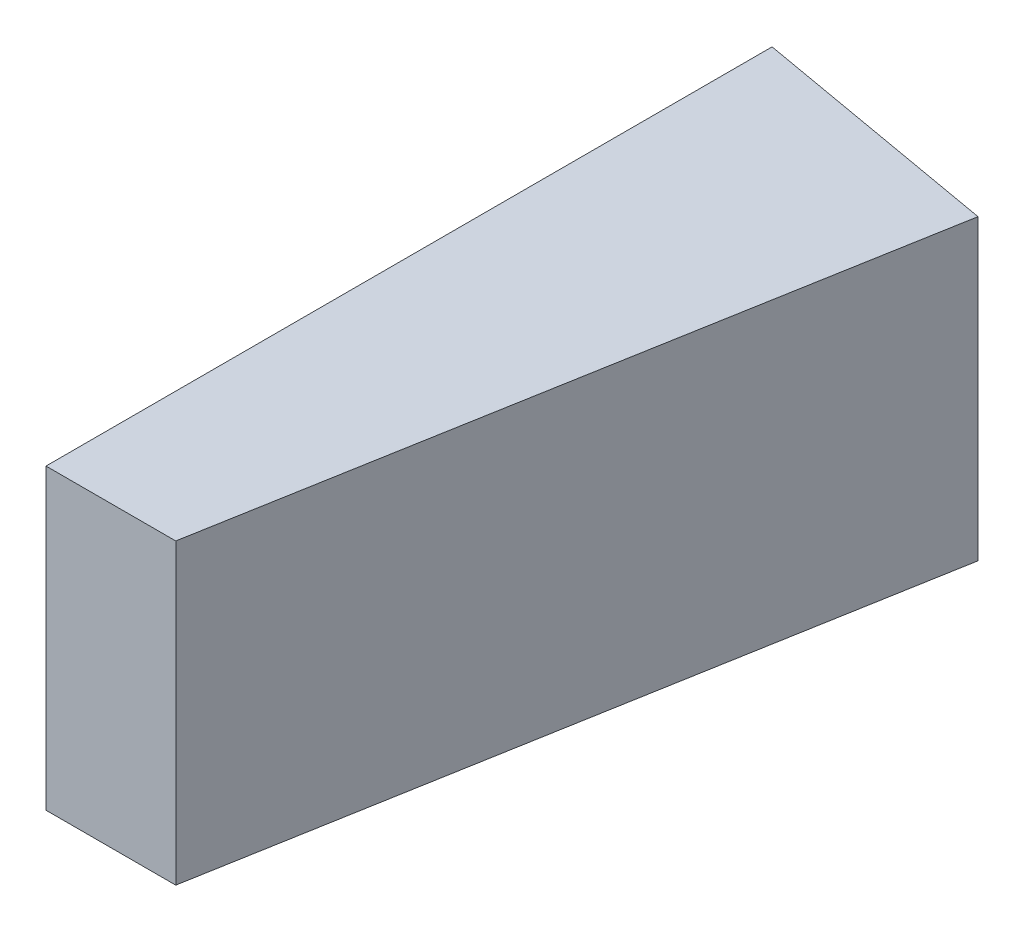
from build123d import *

# Parameters (mm, degrees)
BOSS_EXTRUDE1_DEPTH = 10


with BuildPart() as part:
    # Sketch1 → Boss-Extrude1 (new body)
    with BuildSketch(Plane(origin=(0, 0, 0), x_dir=(1, 0, 0), z_dir=(0, 1, 0))):
        Polygon((0, 0), (0, 24.357740191), (8.387206981, 22.878849308), (4.353048561, 0), align=None)
    extrude(amount=BOSS_EXTRUDE1_DEPTH)


solid = part.part
